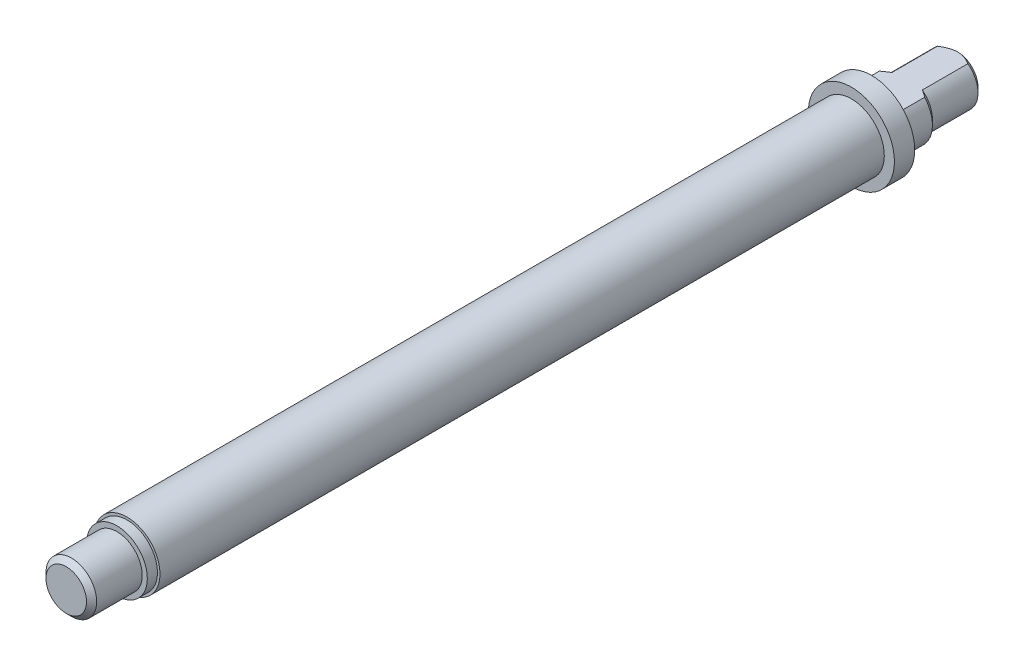
from build123d import *

# Parameters (mm, degrees)
SKETCH_1_R          = 4.25
EXTRUDE_1_DEPTH     = 36.75
SKETCH_2_R          = 3
EXTRUDE_2_DEPTH     = 1
SKETCH_3_R          = 2.5
EXTRUDE_3_DEPTH     = 5
EXTRUDE_START       = 3.5
SKETCH_4_R          = 3
EXTRUDE_4_DEPTH     = 3.5
EXTRUDE_START_2     = 5
SKETCH_5_R          = 2.5
EXTRUDE_5_DEPTH     = 5
CHAMFER_1_SIZE      = 0.5
CHAMFER_2_SIZE      = 0.5
CUT_EXTRUDE_6_REACH = 90.205
SKETCH_6_W          = 6
SKETCH_6_H          = 3
SKETCH_7_R          = 4.25
SKETCH_7_R_2        = 3.25
CUT_EXTRUDE_1_DEPTH = 71.5


with BuildPart() as part:
    # 草图1 → 拉伸1 (new, symmetric)
    with BuildSketch(Plane.XY):
        Circle(SKETCH_1_R)
    extrude(amount=EXTRUDE_1_DEPTH, both=True)

    # 草图2 → 拉伸2 (add)
    with BuildSketch(Plane.XY.offset(36.75)):
        Circle(SKETCH_2_R)
    extrude(amount=EXTRUDE_2_DEPTH)

    # 草图3 → 拉伸3 (add)
    with BuildSketch(Plane.XY.offset(37.75)):
        Circle(SKETCH_3_R)
    extrude(amount=EXTRUDE_3_DEPTH)

    # 草图4 → 拉伸4 (add)
    with BuildSketch(Plane(origin=(0, 0, -36.75), x_dir=(-1, 0, 0), z_dir=(0, 0, -1)).offset(EXTRUDE_START)):
        with Locations(Location((0, 0, 0), (0, 0, 180))):
            Circle(SKETCH_4_R)
    extrude(amount=-EXTRUDE_4_DEPTH)

    # 草图5 → 拉伸5 (add)
    with BuildSketch(Plane(origin=(0, 0, -40.25), x_dir=(-1, 0, 0), z_dir=(0, 0, -1)).offset(EXTRUDE_START_2)):
        with Locations(Location((0, 0, 0), (0, 0, 180))):
            Circle(SKETCH_5_R)
    extrude(amount=-EXTRUDE_5_DEPTH)

    # 倒角1
    chamfer_1_edges = [part.edges().sort_by_distance(p)[0] for p in [
        (-2.5, 0, 42.75),
        (-2.5, 0, -45.25),
    ]]
    chamfer(chamfer_1_edges, length=CHAMFER_1_SIZE)

    # 倒角2
    chamfer_2_edges = [part.edges().sort_by_distance(p)[0] for p in [
        (-3, 0, -40.25),
    ]]
    chamfer(chamfer_2_edges, length=CHAMFER_2_SIZE - 0.0001)  # a hair under: the kernel refuses the full size

    # 拉伸6: up to this face of the body (flat: up to its plane)
    cut_extrude_6_end = Plane(part.part.faces().sort_by_distance((-4.129791847, 0, -36.75))[0])
    # 草图6 → 拉伸6 (cut, up to the picked face)
    with BuildSketch(Plane(origin=(0, 0, -45.25), x_dir=(-1, 0, 0), z_dir=(0, 0, -1)), mode=Mode.PRIVATE) as cut_extrude_6_sk1:
        with Locations((0, 3.5)):
            Rectangle(SKETCH_6_W, SKETCH_6_H)
    cut_extrude_6_tool1 = split(extrude(cut_extrude_6_sk1.sketch, amount=-CUT_EXTRUDE_6_REACH, mode=Mode.PRIVATE), bisect_by=cut_extrude_6_end, keep=Keep.BOTH, mode=Mode.PRIVATE)
    add(cut_extrude_6_tool1.solids().sort_by(Axis((0, 3.5, -45.25), (0, 0, 1)))[0], mode=Mode.SUBTRACT)

    # 草图7 → 切除-拉伸1 (cut)
    with BuildSketch(Plane.XY.offset(36.75)):
        Circle(SKETCH_7_R)
        Circle(SKETCH_7_R_2, mode=Mode.SUBTRACT)
    extrude(amount=-CUT_EXTRUDE_1_DEPTH, mode=Mode.SUBTRACT)


solid = part.part
